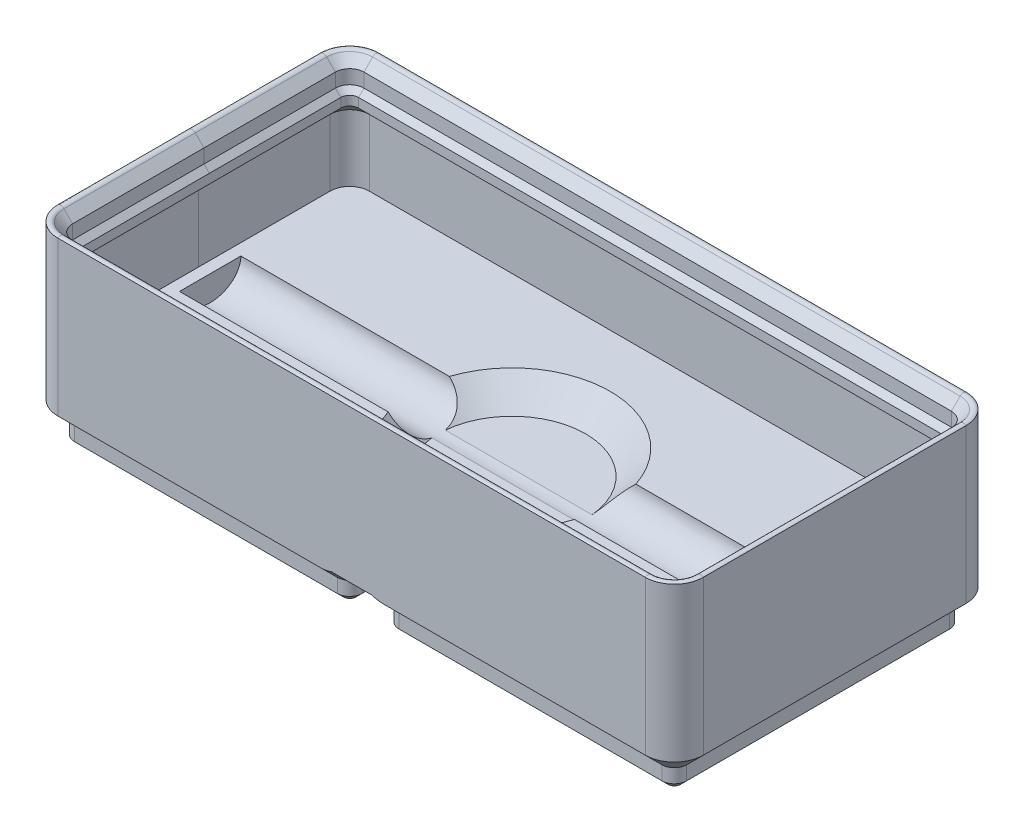
from build123d import *

# Parameters (mm, degrees)
BASE_DEPTH                          = 5
BOX_START                           = -42
BOX_OUTLINE_W                       = 84
BOX_OUTLINE_H                       = 16
BOX_DEPTH                           = 42
CORNER_FILLET_R                     = 4
BASE_CHAMFER_1_SIZE                 = 2.4
BASE_CHAMFER_2_SIZE                 = 0.8
BASE_PATTERN_COUNT                  = 2
BASE_PATTERN_PITCH                  = 42
BASE_CHAMFER_1_OF_BASE_PATTERN_SIZE = 2.4
BASE_CHAMFER_2_OF_BASE_PATTERN_SIZE = 0.8
INTERIOR_CUT_DEPTH                  = 13.8
TOP_EDGE_FILLET_R                   = 0.6
NESTING_CLEARANCE_CUT_DEPTH         = 98.133602789
BOSS_EXTRUDE1_START                 = 2.6
BOSS_EXTRUDE1_DEPTH                 = 2.6
SKETCH17_R                          = 12.7
CUT_EXTRUDE1_DEPTH                  = 3.175
CHAMFER1_SIZE                       = 3.175
CAVITY1_START                       = 2.9475
CAVITY1_DEPTH                       = 78.105


# Read off the part's stored shape, not the designer's step: Box, Cavity1
with BuildPart() as part:
    # Master → Base (new body)
    with BuildSketch(Plane(origin=(0, 0, 0), x_dir=(1, 0, 0), z_dir=(0, 1, 0))):
        with BuildLine():
            Line((4, 2.4), (38, 2.4))
            ThreePointArc((38, 2.4), (39.13137085, 2.86862915), (39.6, 4))
            Line((39.6, 4), (39.6, 38))
            ThreePointArc((39.6, 38), (39.13137085, 39.13137085), (38, 39.6))
            Line((38, 39.6), (4, 39.6))
            ThreePointArc((4, 39.6), (2.86862915, 39.13137085), (2.4, 38))
            Line((2.4, 38), (2.4, 4))
            ThreePointArc((2.4, 4), (2.86862915, 2.86862915), (4, 2.4))
        make_face()
    base = extrude(amount=-BASE_DEPTH)

    # Box outline → Box (add)
    with BuildSketch(Plane.XY.offset(BOX_START)):
        with Locations((42, 8)):
            Rectangle(BOX_OUTLINE_W, BOX_OUTLINE_H)
    extrude(amount=BOX_DEPTH)

    # Corner Fillet
    corner_fillet_edges = [part.edges().sort_by_distance(p)[0] for p in [
        (0, 8, 0),
        (84, 8, 0),
        (84, 8, -42),
        (0, 8, -42),
    ]]
    fillet(corner_fillet_edges, radius=CORNER_FILLET_R)

    # Base Chamfer 1
    base_chamfer_1_edges = [part.edges().sort_by_distance(p)[0] for p in [
        (21, 0, -39.6),
        (2.86862915, 0, -39.13137085),
        (2.4, 0, -21),
        (2.86862915, 0, -2.86862915),
        (21, 0, -2.4),
        (39.13137085, 0, -2.86862915),
        (39.6, 0, -21),
        (39.13137085, 0, -39.13137085),
    ]]
    chamfer(base_chamfer_1_edges, length=BASE_CHAMFER_1_SIZE - 0.0001)  # a hair under: the kernel refuses the full size

    # Base Chamfer 2
    base_chamfer_2_edges = [part.edges().sort_by_distance(p)[0] for p in [
        (2.86862915, -5, -39.13137085),
        (21, -5, -39.6),
        (39.13137085, -5, -39.13137085),
        (39.6, -5, -21),
        (39.13137085, -5, -2.86862915),
        (21, -5, -2.4),
        (2.86862915, -5, -2.86862915),
        (2.4, -5, -21),
    ]]
    chamfer(base_chamfer_2_edges, length=BASE_CHAMFER_2_SIZE)

    # Base Pattern: Base ×2
    with Locations(*[(i * BASE_PATTERN_PITCH, 0, 0) for i in range(1, BASE_PATTERN_COUNT)]):
        add(base)

    # Base Chamfer 1 of Base Pattern
    base_chamfer_1_of_base_pattern_edges = [part.edges().sort_by_distance(p)[0] for p in [
        (63, 0, -39.6),
        (44.86862915, 0, -39.13137085),
        (44.4, 0, -21),
        (44.86862915, 0, -2.86862915),
        (63, 0, -2.4),
        (81.13137085, 0, -2.86862915),
        (81.6, 0, -21),
        (81.13137085, 0, -39.13137085),
    ]]
    chamfer(base_chamfer_1_of_base_pattern_edges, length=BASE_CHAMFER_1_OF_BASE_PATTERN_SIZE - 0.0001)  # a hair under: the kernel refuses the full size

    # Base Chamfer 2 of Base Pattern
    base_chamfer_2_of_base_pattern_edges = [part.edges().sort_by_distance(p)[0] for p in [
        (44.86862915, -5, -39.13137085),
        (63, -5, -39.6),
        (81.13137085, -5, -39.13137085),
        (81.6, -5, -21),
        (81.13137085, -5, -2.86862915),
        (63, -5, -2.4),
        (44.86862915, -5, -2.86862915),
        (44.4, -5, -21),
    ]]
    chamfer(base_chamfer_2_of_base_pattern_edges, length=BASE_CHAMFER_2_OF_BASE_PATTERN_SIZE)

    # Top Nesting Feature: sweep along a path in Sketch5
    with BuildLine(Plane(origin=(0, 16, 0), x_dir=(1, 0, 0), z_dir=(0, 1, 0))) as top_nesting_feature_path:
        Line((4, 0), (80, 0))
        ThreePointArc((80, 0), (82.828427125, 1.171572875), (84, 4))
        Line((84, 4), (84, 38))
        ThreePointArc((84, 38), (82.828427125, 40.828427125), (80, 42))
        Line((80, 42), (4, 42))
        ThreePointArc((4, 42), (1.171572875, 40.828427125), (0, 38))
        Line((0, 38), (0, 4))
        ThreePointArc((0, 4), (1.171572875, 1.171572875), (4, 0))
    # Sketch4 → Top Nesting Feature (sweep)
    with BuildSketch(Plane(origin=(0, 0, -21), x_dir=(-1, 0, 0), z_dir=(0, 0, -1))):
        Polygon((0, 16), (0, 20.646446609), (-2.15, 18.496446609), (-2.15, 16.696446609), (-2.846446609, 16), align=None)
    sweep(path=top_nesting_feature_path.line)

    # Sketch6 → Interior Cut (cut)
    with BuildSketch(Plane(origin=(0, 16, 0), x_dir=(1, 0, 0), z_dir=(0, 1, 0))):
        with BuildLine():
            Line((2.846446609, 38), (2.846446609, 21))
            Line((2.846446609, 21), (2.846446609, 4))
            ThreePointArc((2.846446609, 4), (3.184314575, 3.184314575), (4, 2.846446609))
            Line((4, 2.846446609), (80, 2.846446609))
            ThreePointArc((80, 2.846446609), (80.815685425, 3.184314575), (81.153553391, 4))
            Line((81.153553391, 4), (81.153553391, 38))
            ThreePointArc((81.153553391, 38), (80.815685425, 38.815685425), (80, 39.153553391))
            Line((80, 39.153553391), (4, 39.153553391))
            ThreePointArc((4, 39.153553391), (3.184314575, 38.815685425), (2.846446609, 38))
        make_face()
    extrude(amount=-INTERIOR_CUT_DEPTH, mode=Mode.SUBTRACT)

    # Interior Sweep: sweep along a path in Sketch7
    with BuildLine(Plane(origin=(0, 2.2, 0), x_dir=(1, 0, 0), z_dir=(0, 1, 0))) as interior_sweep_path:
        Line((4, 1.2), (80, 1.2))
        ThreePointArc((80, 1.2), (81.979898987, 2.020101013), (82.8, 4))
        Line((82.8, 4), (82.8, 38))
        ThreePointArc((82.8, 38), (81.979898987, 39.979898987), (80, 40.8))
        Line((80, 40.8), (4, 40.8))
        ThreePointArc((4, 40.8), (2.020101013, 39.979898987), (1.2, 38))
        Line((1.2, 38), (1.2, 4))
        ThreePointArc((1.2, 4), (2.020101013, 2.020101013), (4, 1.2))
    # Sketch8 → Interior Sweep (sweep, cut)
    with BuildSketch(Plane(origin=(0, 0, -21), x_dir=(-1, 0, 0), z_dir=(0, 0, -1))):
        Polygon((-2.846446609, 14.8), (-1.45, 13.403553391), (-1.45, 2.2), (-2.846446609, 2.2), align=None)
    sweep(path=interior_sweep_path.line, mode=Mode.SUBTRACT)

    # Top Edge Fillet
    top_edge_fillet_edges = [part.edges().sort_by_distance(p)[0] for p in [
        (0, 20.646446609, -21),
        (1.171572875, 20.646446609, -1.171572875),
        (42, 20.646446609, 0),
        (82.828427125, 20.646446609, -1.171572875),
        (84, 20.646446609, -21),
        (82.828427125, 20.646446609, -40.828427125),
        (42, 20.646446609, -42),
        (1.171572875, 20.646446609, -40.828427125),
        (0, 20.646446609, -21),
    ]]
    fillet(top_edge_fillet_edges, radius=TOP_EDGE_FILLET_R)

    # Sketch14 → Nesting Clearance Cut (cut, through all)
    with BuildSketch(Plane.XZ.offset(5)):
        with BuildLine():
            Line((-1, -4), (-1, -38))
            ThreePointArc((-1, -38), (0.464466094, -41.535533906), (4, -43))
            Line((4, -43), (80, -43))
            ThreePointArc((80, -43), (83.535533906, -41.535533906), (85, -38))
            Line((85, -38), (85, -4))
            ThreePointArc((85, -4), (83.535533906, -0.464466094), (80, 1))
            Line((80, 1), (4, 1))
            ThreePointArc((4, 1), (0.464466094, -0.464466094), (-1, -4))
        make_face()
        with BuildLine():
            Line((0.25, -4), (0.25, -38))
            ThreePointArc((0.25, -38), (1.348349571, -40.651650429), (4, -41.75))
            Line((4, -41.75), (80, -41.75))
            ThreePointArc((80, -41.75), (82.651650429, -40.651650429), (83.75, -38))
            Line((83.75, -38), (83.75, -4))
            ThreePointArc((83.75, -4), (82.651650429, -1.348349571), (80, -0.25))
            Line((80, -0.25), (4, -0.25))
            ThreePointArc((4, -0.25), (1.348349571, -1.348349571), (0.25, -4))
        make_face(mode=Mode.SUBTRACT)
    extrude(amount=-NESTING_CLEARANCE_CUT_DEPTH, mode=Mode.SUBTRACT)

    # Sketch16 → Boss-Extrude1 (add)
    with BuildSketch(Plane(origin=(0, 2.2, 0), x_dir=(1, 0, 0), z_dir=(0, 1, 0)).offset(BOSS_EXTRUDE1_START)):
        with BuildLine():
            Line((82.55, 4), (82.55, 38))
            ThreePointArc((82.55, 38), (81.803122292, 39.803122292), (80, 40.55))
            Line((80, 40.55), (4, 40.55))
            ThreePointArc((4, 40.55), (2.196877708, 39.803122292), (1.45, 38))
            Line((1.45, 38), (1.45, 21))
            Line((1.45, 21), (1.45, 4))
            ThreePointArc((1.45, 4), (1.519917935, 3.406962941), (1.72583761, 2.846446609))
            ThreePointArc((1.72583761, 2.846446609), (2.66565768, 1.826976629), (4, 1.45))
            Line((4, 1.45), (80, 1.45))
            ThreePointArc((80, 1.45), (81.33434232, 1.826976629), (82.27416239, 2.846446609))
            ThreePointArc((82.27416239, 2.846446609), (82.480082065, 3.406962941), (82.55, 4))
        make_face()
    extrude(amount=-BOSS_EXTRUDE1_DEPTH)

    # Sketch17 → Cut-Extrude1 (cut)
    with BuildSketch(Plane(origin=(0, 4.8, 0), x_dir=(1, 0, 0), z_dir=(0, 1, 0))):
        with Locations(Location((42, 21, 0), (0, 0, 180))):
            Circle(SKETCH17_R)
    extrude(amount=-CUT_EXTRUDE1_DEPTH, mode=Mode.SUBTRACT)

    # Chamfer1
    chamfer1_edges = [part.edges().sort_by_distance(p)[0] for p in [
        (54.7, 1.625, -21),
    ]]
    chamfer(chamfer1_edges, length=CHAMFER1_SIZE - 0.0001)  # a hair under: the kernel refuses the full size

    # Cavity1 outline → Cavity1 (cut)
    with BuildSketch(Plane.YZ.offset(CAVITY1_START)):
        with BuildLine():
            Line((4.8, -24.96875), (4.8, -17.03125))
            add(Edge.make_bspline(
                [(4.8, -17.03125), (4.31787037, -17.03125), (3.775204942, -17.133270414), (3.08348025, -17.405721884), (2.35645799, -18.010361826), (1.834085366, -18.99555696), (1.572728659, -20.412124479), (1.540332494, -20.703890415), (1.529358934, -21), (1.540332494, -21.296109585), (1.572728659, -21.587875521), (1.834085366, -23.00444304), (2.35645799, -23.989638174), (3.08348025, -24.594278116), (3.775204942, -24.866729586), (4.31787037, -24.96875), (4.8, -24.96875)],
                knots=[0.777777778, 0.777777778, 0.777777778, 0.777777778, 0.777777778, 0.777777778, 0.777777778, 1, 1, 1, 1, 1, 1.055555556, 1.055555556, 1.055555556, 1.055555556, 1.055555556, 1.277777778, 1.277777778, 1.277777778, 1.277777778, 1.277777778, 1.277777778, 1.277777778], degree=6, weights=[1, 1, 1.024566995, 1.0234807, 1.006740604, 1, 1, 0.999841364, 0.999762046, 0.999841364, 1, 1, 1.006740604, 1.0234807, 1.024566995, 1, 1]))
        make_face()
    extrude(amount=CAVITY1_DEPTH, mode=Mode.SUBTRACT)


solid = part.part
